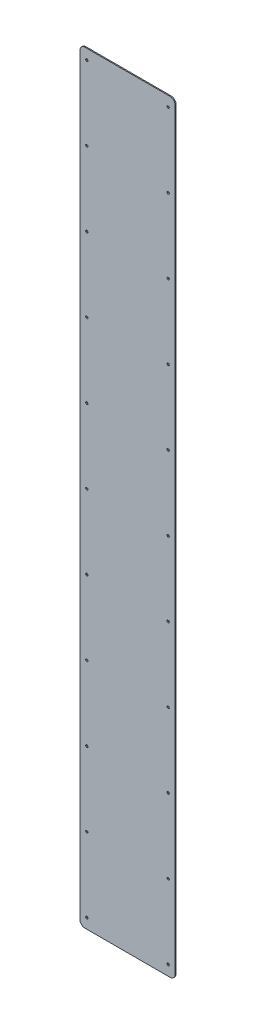
from build123d import *

# Parameters (mm, degrees)
SKETCH1_R          = 2.25
BASE_FLANGE1_DEPTH = 2


# Sheet-metal steps are written as plain solids
with BuildPart() as part:
    # Sketch1 → Base-Flange1 (new body)
    with BuildSketch(Plane.XY):
        with BuildLine():
            Line((10, 0), (177.2, 0))
            ThreePointArc((177.2, 0), (184.271067812, 2.928932188), (187.2, 10))
            Line((187.2, 10), (187.2, 1490))
            ThreePointArc((187.2, 1490), (184.271067812, 1497.071067812), (177.2, 1500))
            Line((177.2, 1500), (10, 1500))
            ThreePointArc((10, 1500), (2.928932188, 1497.071067812), (0, 1490))
            Line((0, 1490), (0, 10))
            ThreePointArc((0, 10), (2.928932188, 2.928932188), (10, 0))
        make_face()
        with Locations((13.6, 1480)):
            Circle(SKETCH1_R, mode=Mode.SUBTRACT)
        with Locations((173.6, 1480)):
            Circle(SKETCH1_R, mode=Mode.SUBTRACT)
        with Locations((173.6, 1334)):
            Circle(SKETCH1_R, mode=Mode.SUBTRACT)
        with Locations((173.6, 1188)):
            Circle(SKETCH1_R, mode=Mode.SUBTRACT)
        with Locations((173.6, 1042)):
            Circle(SKETCH1_R, mode=Mode.SUBTRACT)
        with Locations((173.6, 896)):
            Circle(SKETCH1_R, mode=Mode.SUBTRACT)
        with Locations((173.6, 750)):
            Circle(SKETCH1_R, mode=Mode.SUBTRACT)
        with Locations((173.6, 604)):
            Circle(SKETCH1_R, mode=Mode.SUBTRACT)
        with Locations((173.6, 458)):
            Circle(SKETCH1_R, mode=Mode.SUBTRACT)
        with Locations((173.6, 312)):
            Circle(SKETCH1_R, mode=Mode.SUBTRACT)
        with Locations((173.6, 166)):
            Circle(SKETCH1_R, mode=Mode.SUBTRACT)
        with Locations((173.6, 20)):
            Circle(SKETCH1_R, mode=Mode.SUBTRACT)
        with Locations((13.6, 1334)):
            Circle(SKETCH1_R, mode=Mode.SUBTRACT)
        with Locations((13.6, 1188)):
            Circle(SKETCH1_R, mode=Mode.SUBTRACT)
        with Locations((13.6, 1042)):
            Circle(SKETCH1_R, mode=Mode.SUBTRACT)
        with Locations((13.6, 896)):
            Circle(SKETCH1_R, mode=Mode.SUBTRACT)
        with Locations((13.6, 750)):
            Circle(SKETCH1_R, mode=Mode.SUBTRACT)
        with Locations((13.6, 604)):
            Circle(SKETCH1_R, mode=Mode.SUBTRACT)
        with Locations((13.6, 458)):
            Circle(SKETCH1_R, mode=Mode.SUBTRACT)
        with Locations((13.6, 312)):
            Circle(SKETCH1_R, mode=Mode.SUBTRACT)
        with Locations((13.6, 166)):
            Circle(SKETCH1_R, mode=Mode.SUBTRACT)
        with Locations((13.6, 20)):
            Circle(SKETCH1_R, mode=Mode.SUBTRACT)
    extrude(amount=-BASE_FLANGE1_DEPTH)


solid = part.part
